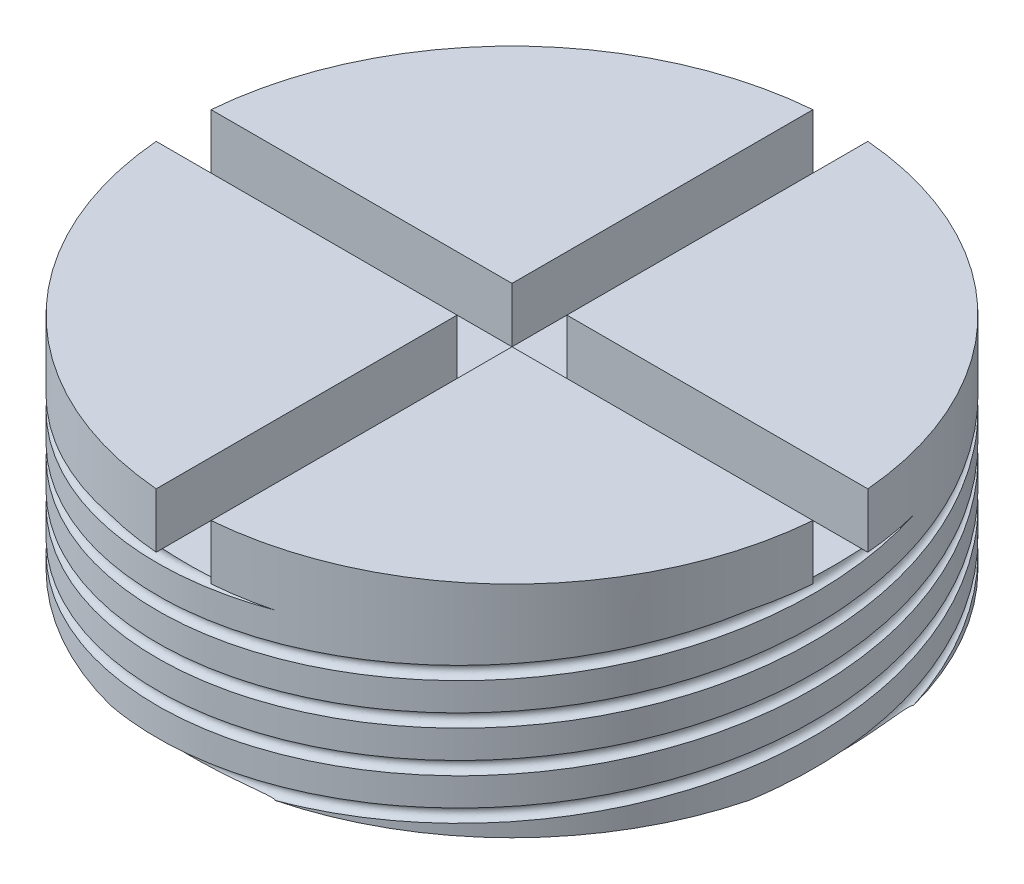
from build123d import *

# Parameters (mm, degrees)
BOSS_EXTRUDE1_DEPTH   = 20
BOSS_EXTRUDE1_2_DEPTH = 20
BOSS_EXTRUDE1_3_DEPTH = 20
BOSS_EXTRUDE1_4_DEPTH = 20
SKETCH1_4_R           = 30
SKETCH1_4_R_2         = 2.5
BOSS_EXTRUDE2_DEPTH   = 15
CUT_SWEEP1_PITCH      = 15
CUT_SWEEP1_FROM       = 0
CIRPATTERN1_COUNT     = 4


with BuildPart() as part:
    # Sketch1 → Boss-Extrude1 (new body)
    with BuildSketch(Plane(origin=(0, 0, 0), x_dir=(1, 0, 0), z_dir=(0, 1, 0))):
        with BuildLine():
            Line((-2.5, 2.5), (-2.5, 29.895651858))
            ThreePointArc((-2.5, 29.895651858), (-21.213203436, 21.213203436), (-29.895651858, 2.5))
            Line((-29.895651858, 2.5), (-2.5, 2.5))
        make_face()
    extrude(amount=BOSS_EXTRUDE1_DEPTH)



with BuildPart() as body_2:
    # Sketch1 → Boss-Extrude1 2 (new body)
    with BuildSketch(Plane(origin=(0, 0, 0), x_dir=(1, 0, 0), z_dir=(0, 1, 0))):
        with BuildLine():
            Line((-2.5, -2.5), (-29.895651858, -2.5))
            ThreePointArc((-29.895651858, -2.5), (-21.213203436, -21.213203436), (-2.5, -29.895651858))
            Line((-2.5, -29.895651858), (-2.5, -2.5))
        make_face()
    extrude(amount=BOSS_EXTRUDE1_2_DEPTH)


with BuildPart() as body_3:
    # Sketch1 → Boss-Extrude1 3 (new body)
    with BuildSketch(Plane(origin=(0, 0, 0), x_dir=(1, 0, 0), z_dir=(0, 1, 0))):
        with BuildLine():
            ThreePointArc((2.5, -29.895651858), (21.213203436, -21.213203436), (29.895651858, -2.5))
            Line((29.895651858, -2.5), (2.5, -2.5))
            Line((2.5, -2.5), (2.5, -29.895651858))
        make_face()
    extrude(amount=BOSS_EXTRUDE1_3_DEPTH)


with BuildPart() as body_4:
    # Sketch1 → Boss-Extrude1 4 (new body)
    with BuildSketch(Plane(origin=(0, 0, 0), x_dir=(1, 0, 0), z_dir=(0, 1, 0))):
        with BuildLine():
            ThreePointArc((29.895651858, 2.5), (21.213203436, 21.213203436), (2.5, 29.895651858))
            Line((2.5, 29.895651858), (2.5, 2.5))
            Line((2.5, 2.5), (29.895651858, 2.5))
        make_face()
    extrude(amount=BOSS_EXTRUDE1_4_DEPTH)


with BuildPart() as part_1:
    add(part.part)

    add(body_2.part)  # Boss-Extrude2 merges body 2

    add(body_3.part)  # Boss-Extrude2 merges body 3

    add(body_4.part)  # Boss-Extrude2 merges body 4
    # Sketch1<4> → Boss-Extrude2 (add)
    with BuildSketch(Plane(origin=(0, 0, 0), x_dir=(1, 0, 0), z_dir=(0, 1, 0))):
        with Locations(Location((0, 0, 0), (0, 0, 94.780191847))):
            Circle(SKETCH1_4_R)
        with Locations(Location((0, 0, 0), (0, 0, 270))):
            Circle(SKETCH1_4_R_2, mode=Mode.SUBTRACT)
    extrude(amount=BOSS_EXTRUDE2_DEPTH)

    # Cut-Sweep1: arcs per turn and ends read off the stored shape
    # Cut-Sweep1: the profile of Cut-Sweep1 profile screwed along a right-hand helix through 2.555556 turns, 18 arcs to a turn; built about Z, then put on its axis
    cut_sweep1_z = Axis((0, 0, 0), (0, 0, 1))
    cut_sweep1_corners = [(30, -0.047596018, -14.401890797), (30.6, 0, -15), (30, 0.047596018, -15.598109203), (29.4, 0, -15)]
    with BuildLine(mode=Mode.PRIVATE) as cut_sweep1_profile:
        ThreePointArc((30, -0.047596018, -14.401890797), (30.424264069, -0.033655467, -14.577072926), (30.6, 0, -15))
        ThreePointArc((30.6, 0, -15), (30.424264069, 0.033655467, -15.422927074), (30, 0.047596018, -15.598109203))
        ThreePointArc((30, 0.047596018, -15.598109203), (29.575735931, 0.033655467, -15.422927074), (29.4, 0, -15))
        ThreePointArc((29.4, 0, -15), (29.575735931, -0.033655467, -14.577072926), (30, -0.047596018, -14.401890797))
    cut_sweep1_cap = Face(cut_sweep1_profile.wire())
    cut_sweep1_arcs = [((30, -0.047596018, -14.401890797), (30.6, -0.047596018, -14.401890797), (30.6, 0, -15), (1, 0.7071067811865476, 1)), ((30.6, 0, -15), (30.6, 0.047596018, -15.598109203), (30, 0.047596018, -15.598109203), (1, 0.7071067811865476, 1)), ((30, 0.047596018, -15.598109203), (29.4, 0.047596018, -15.598109203), (29.4, 0, -15), (1, 0.7071067811865476, 1)), ((29.4, 0, -15), (29.4, -0.047596018, -14.401890797), (30, -0.047596018, -14.401890797), (1, 0.7071067811865476, 1))]  # start, shoulder, end, weights
    cut_sweep1_turn_angles = [0, 10, 20, 30, 40, 50, 60, 70, 80, 90, 100, 110, 120, 130, 140, 150, 160, 170, 180, 190, 200, 210, 220, 230, 240, 250, 260, 270, 280, 290, 300, 310, 320, 330, 340, 350, 360]
    cut_sweep1_turn_weights = [1, 0.984807753012208, 1, 0.984807753012208, 1, 0.984807753012208, 1, 0.984807753012208, 1, 0.984807753012208, 1, 0.984807753012208, 1, 0.984807753012208, 1, 0.984807753012208, 1, 0.984807753012208, 1, 0.984807753012208, 1, 0.984807753012208, 1, 0.984807753012208, 1, 0.984807753012208, 1, 0.984807753012208, 1, 0.984807753012208, 1, 0.984807753012208, 1, 0.984807753012208, 1, 0.984807753012208, 1]
    cut_sweep1_turn_sides = [Face.make_bezier_surface([[Vector(p[j][0], p[j][1], 0).rotate(cut_sweep1_z, cut_sweep1_turn_angles[2 * i + k]) / cut_sweep1_turn_weights[2 * i + k] + Vector(0, 0, p[j][2] + CUT_SWEEP1_PITCH * cut_sweep1_turn_angles[2 * i + k] / 360) for k in range(3)] for j in range(3)], [[p[3][j] * cut_sweep1_turn_weights[2 * i + k] for k in range(3)] for j in range(3)]) for p in cut_sweep1_arcs for i in range(18)]
    cut_sweep1_last_angles = [720, 730, 740, 750, 760, 770, 780, 790, 800, 810, 820, 830, 840, 850, 860, 870, 880, 890, 900, 910, 920]
    cut_sweep1_last_weights = [1, 0.984807753012208, 1, 0.984807753012208, 1, 0.984807753012208, 1, 0.984807753012208, 1, 0.984807753012208, 1, 0.984807753012208, 1, 0.984807753012208, 1, 0.984807753012208, 1, 0.984807753012208, 1, 0.984807753012208, 1]
    cut_sweep1_last_sides = [Face.make_bezier_surface([[Vector(p[j][0], p[j][1], 0).rotate(cut_sweep1_z, cut_sweep1_last_angles[2 * i + k]) / cut_sweep1_last_weights[2 * i + k] + Vector(0, 0, p[j][2] + CUT_SWEEP1_PITCH * cut_sweep1_last_angles[2 * i + k] / 360) for k in range(3)] for j in range(3)], [[p[3][j] * cut_sweep1_last_weights[2 * i + k] for k in range(3)] for j in range(3)]) for p in cut_sweep1_arcs for i in range(10)]
    cut_sweep1 = Plane(origin=(0, 15, 0), x_dir=(-1, 0, 0), z_dir=(0, -1, 0)) * split(Solid(Shell([*[p.moved(Location((0, 0, CUT_SWEEP1_PITCH * i))) for i in range(2) for p in cut_sweep1_turn_sides], *cut_sweep1_last_sides, cut_sweep1_cap, cut_sweep1_cap.rotate(cut_sweep1_z, 920).moved(Location((0, 0, CUT_SWEEP1_PITCH * 920 / 360)))])), bisect_by=Plane.XY.offset(CUT_SWEEP1_FROM), keep=Keep.TOP, mode=Mode.PRIVATE)
    add(cut_sweep1, mode=Mode.SUBTRACT)

    # CirPattern1: Cut-Sweep1 ×4 about axis
    cirpattern1_axis = Axis((0, 0, 0), (0, -1, 0))
    for i in range(1, CIRPATTERN1_COUNT):
        add(cut_sweep1.rotate(cirpattern1_axis, i * 360 / CIRPATTERN1_COUNT), mode=Mode.SUBTRACT)


solid = part_1.part
